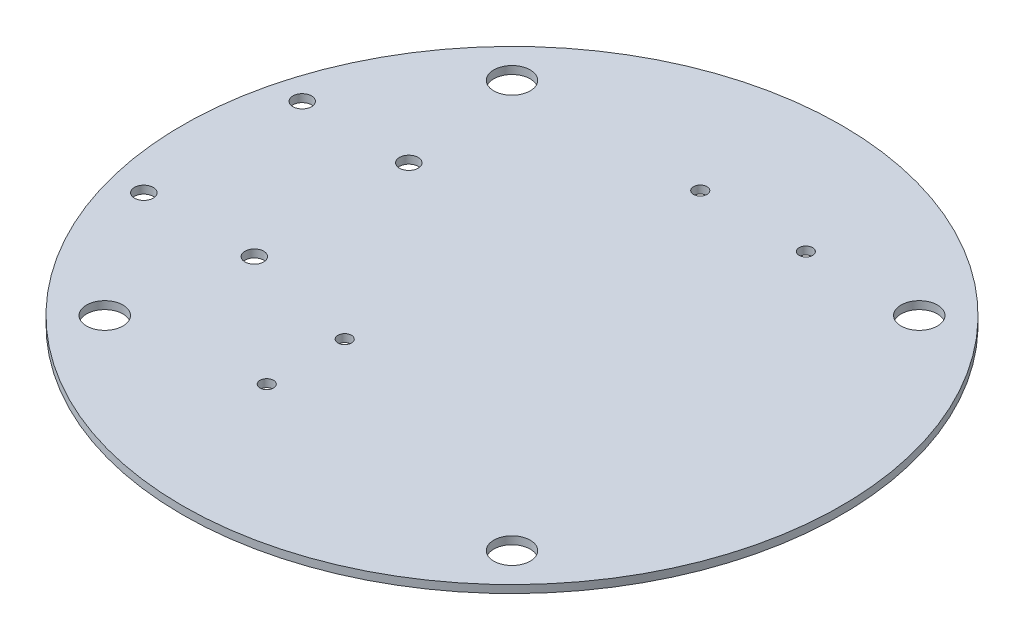
from build123d import *

# Parameters (mm, degrees)
SKETCH1_R            = 63.4
BOSS_EXTRUDE1_DEPTH  = 1.5
M6_CLEARANCE_HOLE1_D = 7
CIRPATTERN1_COUNT    = 4
M2_CLEARANCE_HOLE1_D = 2.6
M3_CLEARANCE_HOLE2_D = 3.6


with BuildPart() as part:
    # Sketch1 → Boss-Extrude1 (new body)
    with BuildSketch(Plane(origin=(0, 0, 0), x_dir=(1, 0, 0), z_dir=(0, 1, 0))):
        Circle(SKETCH1_R)
    extrude(amount=BOSS_EXTRUDE1_DEPTH)

    # M6 Clearance Hole1 (through all)
    with Locations(Plane(origin=(0, 1.5, 0), x_dir=(1, 0, 0), z_dir=(0, 1, 0))):
        with Locations((-39.173715678, -39.173715678)):
            m6_clearance_hole1 = Hole(M6_CLEARANCE_HOLE1_D / 2)

    # CirPattern1: M6 Clearance Hole1 ×4 about axis
    cirpattern1_axis = Axis((0, 1.5, 0), (0, -1, 0))
    for i in range(1, CIRPATTERN1_COUNT):
        add(m6_clearance_hole1.rotate(cirpattern1_axis, i * 360 / CIRPATTERN1_COUNT), mode=Mode.SUBTRACT)

    # M2 Clearance Hole1 (through all)
    with Locations(Plane(origin=(0, 1.5, 0), x_dir=(1, 0, 0), z_dir=(0, 1, 0))):
        with Locations((-2.709999951, 38.930000111), (17.610000128, 38.930000136), (-12.154, -20.027269068), (-12.154, -35.027269068)):
            Hole(M2_CLEARANCE_HOLE1_D / 2)

    # M3 Clearance Hole2 (through all)
    with Locations(Plane(origin=(0, 1.5, 0), x_dir=(1, 0, 0), z_dir=(0, 1, 0))):
        with Locations((-55.86454119, 15.511690642), (-55.864546519, -14.968309358), (-34.604546519, -14.968313075), (-35.36654119, 15.511687058)):
            Hole(M3_CLEARANCE_HOLE2_D / 2)


solid = part.part
